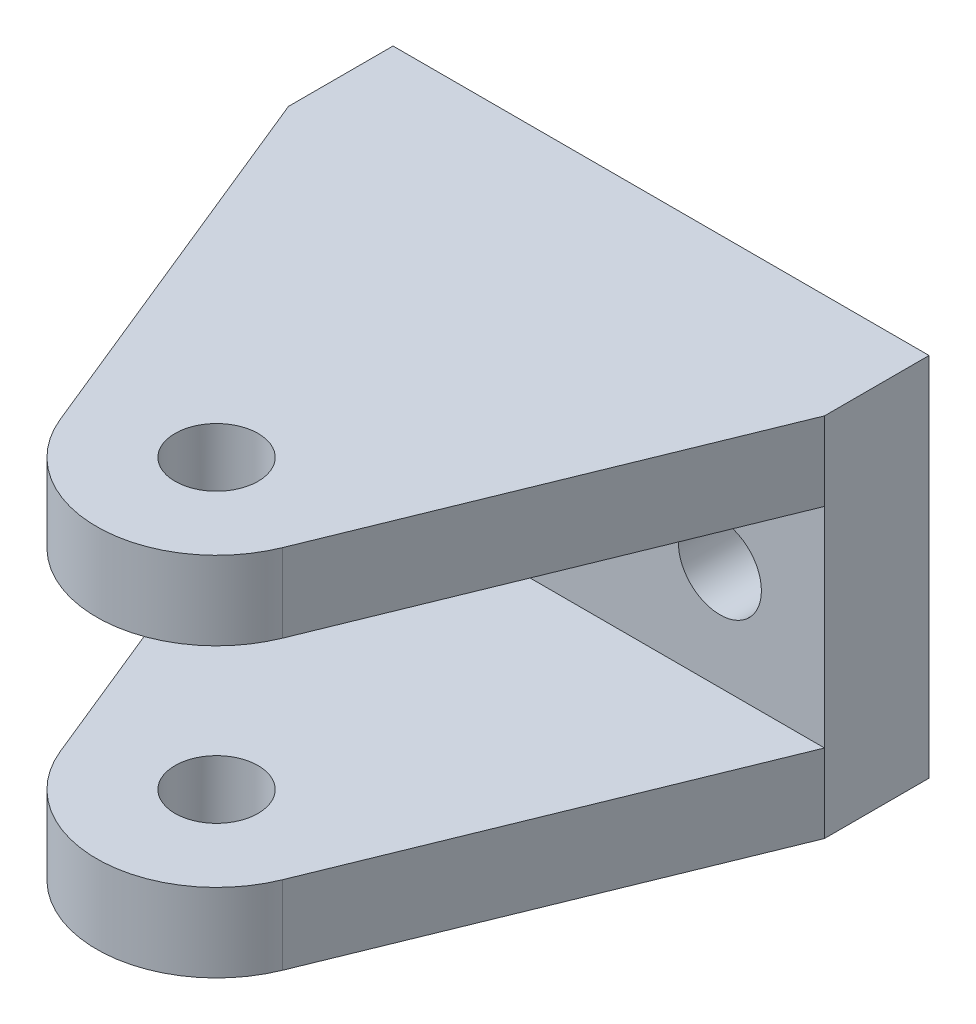
from build123d import *

# Parameters (mm, degrees)
SKETCH1_W                      = 41
SKETCH1_H                      = 28
SKETCH1_R                      = 3.175
BOSS_EXTRUDE1_DEPTH            = 8
SKETCH2_W                      = 41
SKETCH2_H                      = 6
BOSS_EXTRUDE2_DEPTH            = 53
CUT_EXTRUDE1_REACH             = 67.858
SKETCH4_R                      = 3.175
CUT_EXTRUDE1_DIRECTION_2_REACH = 67.858
CUT_EXTRUDE2_REACH             = 67.858
CUT_EXTRUDE2_DIRECTION_2_REACH = 67.858


with BuildPart() as part:
    # Sketch1 → Boss-Extrude1 (new body)
    with BuildSketch(Plane.XY):
        Rectangle(SKETCH1_W, SKETCH1_H)
        with Locations((12.5, 0)):
            Circle(SKETCH1_R, mode=Mode.SUBTRACT)
        with Locations((-12.5, 0)):
            Circle(SKETCH1_R, mode=Mode.SUBTRACT)
    extrude(amount=BOSS_EXTRUDE1_DEPTH)

    # Sketch2 → Boss-Extrude2 (add)
    with BuildSketch(Plane.XY.offset(8)):
        with Locations((0, 11)):
            Rectangle(SKETCH2_W, SKETCH2_H)
        with Locations((0, -11)):
            Rectangle(SKETCH2_W, SKETCH2_H)
    extrude(amount=BOSS_EXTRUDE2_DEPTH)

    # Cut-Extrude1: up to this face of the body (flat: up to its plane)
    cut_extrude1_end = Plane(part.part.faces().sort_by_distance((0, -14, 30.5))[0])
    # Sketch4 → Cut-Extrude1 (cut, up to the picked face)
    with BuildSketch(Plane(origin=(0, 0, 0), x_dir=(1, 0, 0), z_dir=(0, 1, 0)), mode=Mode.PRIVATE) as cut_extrude1_sk1:
        with Locations((0, -34)):
            Circle(SKETCH4_R)
    cut_extrude1_tool1 = split(extrude(cut_extrude1_sk1.sketch, amount=-CUT_EXTRUDE1_REACH, mode=Mode.PRIVATE), bisect_by=cut_extrude1_end, keep=Keep.BOTH, mode=Mode.PRIVATE)
    add(cut_extrude1_tool1.solids().sort_by(Axis((0, 0, 34), (0, -1, 0)))[0], mode=Mode.SUBTRACT)

    # Cut-Extrude1 direction 2: up to this face of the body (flat: up to its plane)
    cut_extrude1_direction_2_end = Plane(part.part.faces().sort_by_distance((0, 14, 30.5))[0])
    # Sketch4 → Cut-Extrude1 direction 2 (cut, up to the picked face)
    with BuildSketch(Plane(origin=(0, 0, 0), x_dir=(1, 0, 0), z_dir=(0, 1, 0)), mode=Mode.PRIVATE) as cut_extrude1_direction_2_sk1:
        with Locations((0, -34)):
            Circle(SKETCH4_R)
    cut_extrude1_direction_2_tool1 = split(extrude(cut_extrude1_direction_2_sk1.sketch, amount=CUT_EXTRUDE1_DIRECTION_2_REACH, mode=Mode.PRIVATE), bisect_by=cut_extrude1_direction_2_end, keep=Keep.BOTH, mode=Mode.PRIVATE)
    add(cut_extrude1_direction_2_tool1.solids().sort_by(Axis((0, 0, 34), (0, 1, 0)))[0], mode=Mode.SUBTRACT)

    # Cut-Extrude2: up to this face of the body (flat: up to its plane)
    cut_extrude2_end = Plane(part.part.faces().sort_by_distance((0, -14, 30.455112429))[0])
    # Sketch5 → Cut-Extrude2 (cut, up to the picked face)
    with BuildSketch(Plane(origin=(0, 0, 0), x_dir=(1, 0, 0), z_dir=(0, 1, 0)), mode=Mode.PRIVATE) as cut_extrude2_sk1:
        with BuildLine():
            Line((20.5, -61), (20.5, -8))
            Line((20.5, -8), (8.496878434, -37.461745496))
            ThreePointArc((8.496878434, -37.461745496), (0, -43.175), (-8.496878434, -37.461745496))
            Line((-8.496878434, -37.461745496), (-20.5, -8))
            Line((-20.5, -8), (-20.5, -61))
            Line((-20.5, -61), (20.5, -61))
        make_face()
    cut_extrude2_tool1 = split(extrude(cut_extrude2_sk1.sketch, amount=-CUT_EXTRUDE2_REACH, mode=Mode.PRIVATE), bisect_by=cut_extrude2_end, keep=Keep.BOTH, mode=Mode.PRIVATE)
    add(cut_extrude2_tool1.solids().sort_by(Axis((0, 0, 43.644879), (0, -1, 0)))[0], mode=Mode.SUBTRACT)

    # Cut-Extrude2 direction 2: up to this face of the body (flat: up to its plane)
    cut_extrude2_direction_2_end = Plane(part.part.faces().sort_by_distance((0, 14, 30.455112429))[0])
    # Sketch5 → Cut-Extrude2 direction 2 (cut, up to the picked face)
    with BuildSketch(Plane(origin=(0, 0, 0), x_dir=(1, 0, 0), z_dir=(0, 1, 0)), mode=Mode.PRIVATE) as cut_extrude2_direction_2_sk1:
        with BuildLine():
            Line((20.5, -61), (20.5, -8))
            Line((20.5, -8), (8.496878434, -37.461745496))
            ThreePointArc((8.496878434, -37.461745496), (0, -43.175), (-8.496878434, -37.461745496))
            Line((-8.496878434, -37.461745496), (-20.5, -8))
            Line((-20.5, -8), (-20.5, -61))
            Line((-20.5, -61), (20.5, -61))
        make_face()
    cut_extrude2_direction_2_tool1 = split(extrude(cut_extrude2_direction_2_sk1.sketch, amount=CUT_EXTRUDE2_DIRECTION_2_REACH, mode=Mode.PRIVATE), bisect_by=cut_extrude2_direction_2_end, keep=Keep.BOTH, mode=Mode.PRIVATE)
    add(cut_extrude2_direction_2_tool1.solids().sort_by(Axis((0, 0, 43.644879), (0, 1, 0)))[0], mode=Mode.SUBTRACT)


solid = part.part
